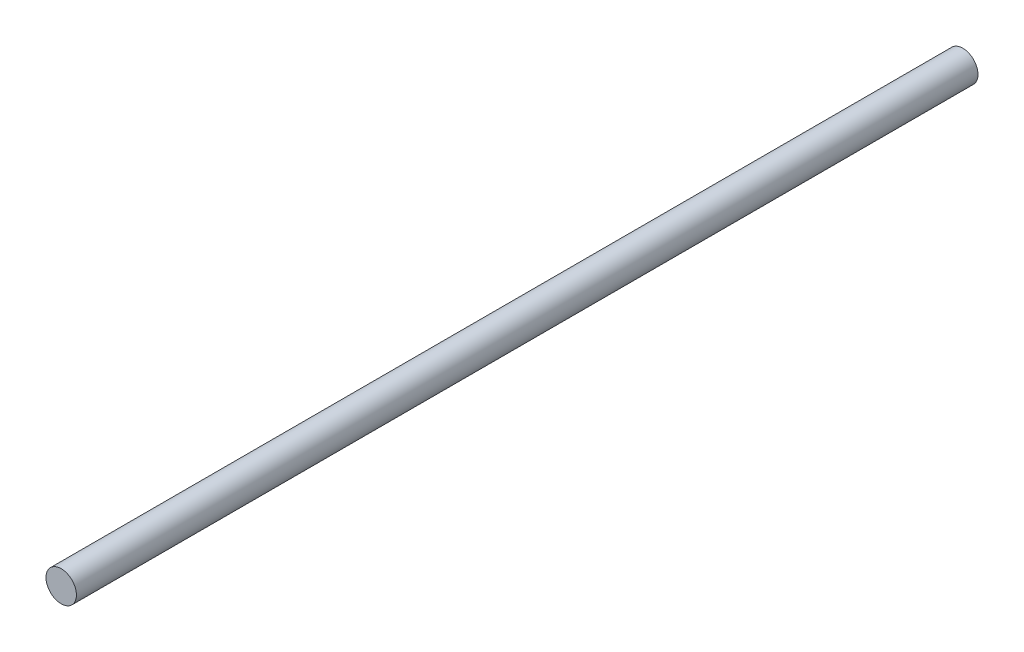
from build123d import *

# Parameters (mm, degrees)
SKETCH1_R           = 3.175
BOSS_EXTRUDE1_DEPTH = 188


with BuildPart() as part:
    # Sketch1 → Boss-Extrude1 (new body)
    with BuildSketch(Plane.XY):
        Circle(SKETCH1_R)
    extrude(amount=BOSS_EXTRUDE1_DEPTH)


solid = part.part
